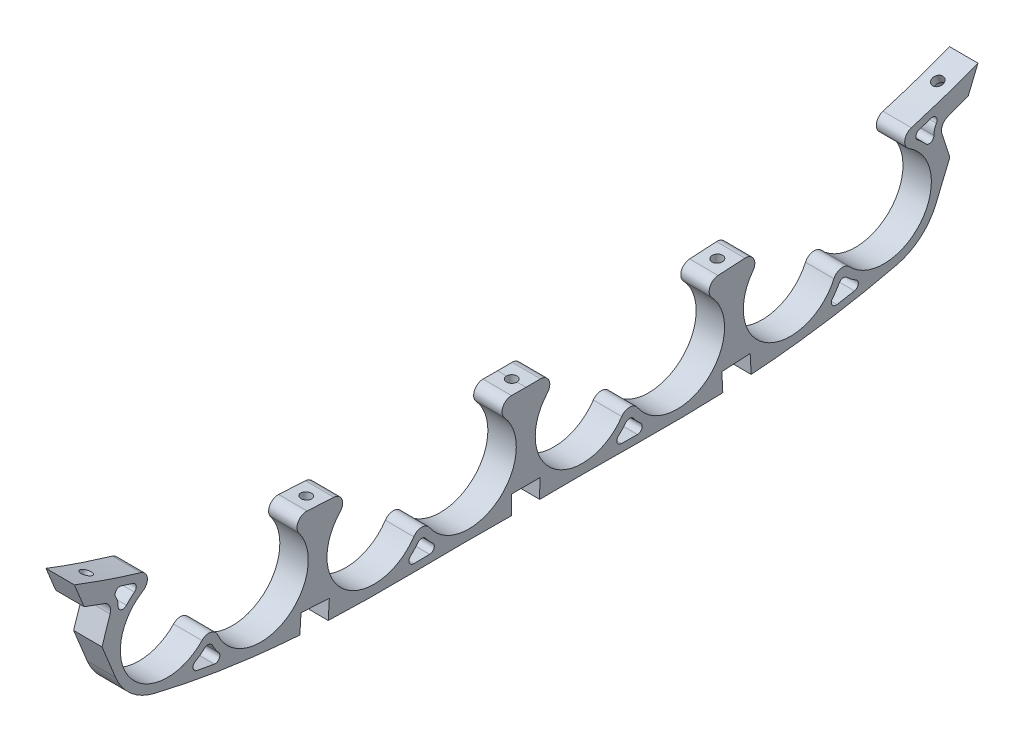
from build123d import *

# Parameters (mm, degrees)
BOSS_EXTRUDE2_START = -4.7625
BOSS_EXTRUDE2_DEPTH = 9.525
CUT_EXTRUDE1_DEPTH  = 156.415453264
SKETCH3_R           = 1.778
CUT_EXTRUDE2_DEPTH  = 156.084029674
SKETCH4_R           = 1.778
CUT_EXTRUDE3_DEPTH  = 154.633346002
SKETCH5_R           = 3.175
CUT_EXTRUDE4_DEPTH  = 3.556
SKETCH6_R           = 1.778
CUT_EXTRUDE5_DEPTH  = 141.617711282


# Read off the part's stored shape, not the designer's step: Boss-Extrude2
with BuildPart() as part:
    # Boss-Extrude2 outline → Boss-Extrude2 (new body)
    with BuildSketch(Plane(origin=(-4.793989049, 0.020738597, -8e-09), x_dir=(-1.5740645192279891e-09, 3.5988585896806374e-12, 1.0), z_dir=(-0.9999906431736159, 0.00432591784689156, -1.5740653593461668e-09)).offset(BOSS_EXTRUDE2_START)):
        with BuildLine():
            Line((-138.072044535, -17.418672385), (-133.45193308, -28.653173914))
            ThreePointArc((-133.45193308, -28.653173914), (-128.289952655, -35.791230264), (-120.447393147, -39.802732565))
            add(Edge.make_bspline(
                [(-120.447393147, -39.802732565), (-119.532951115, -40.023476944), (-117.088169027, -40.601323697), (-110.953698267, -41.968369708), (-101.9631708, -43.710437587), (-90.800466979, -45.403836777), (-79.689088478, -46.662973433), (-68.62645086, -47.527275454), (-57.58924724, -48.037878216), (-46.678774083, -48.224931934), (-36.12400945, -48.204712413), (-25.891642086, -48.098211972), (-17.621930281, -48.025348577), (-11.245188421, -48.026081616), (-6.353163032, -48.062670944), (-2.777855823, -48.097005295), (-0.863208778, -48.112845404), (-0.665350758, -48.114448781)],
                knots=[0.270797205, 0.270797205, 0.270797205, 0.270797205, 0.286422205, 0.3125, 0.375, 0.4375, 0.5, 0.5625, 0.625, 0.6875, 0.75, 0.8125, 0.875, 0.90625, 0.9375, 0.96875, 0.972344137, 0.972344137, 0.972344137, 0.972344137], degree=3))
            Line((-0.665350758, -48.114448781), (-0.665350758, -41.793027475))
            Line((-0.665350758, -41.793027475), (4.097149249, -41.793027475))
            Line((4.097149249, -41.793027475), (4.097149249, -13.091259669))
            add(Edge.make_bspline(
                [(-0.77284529, -13.060384989), (0.850702359, -13.073891325), (2.474025926, -13.085351705), (4.097149249, -13.091259669)],
                knots=[0.969923956, 0.969923956, 0.969923956, 0.969923956, 1, 1, 1, 1], degree=3))
            ThreePointArc((-0.77284529, -13.060384989), (-3.639917153, -14.954181234), (-3.104472125, -18.348273735))
            ThreePointArc((-3.104472125, -18.348273735), (-5.224674561, -41.458905114), (-28.135499878, -37.75882074))
            ThreePointArc((-28.135499878, -37.75882074), (-30.788793596, -36.352857657), (-33.427092785, -37.786760419))
            ThreePointArc((-33.427092785, -37.786760419), (-56.555344229, -41.528795139), (-58.222773785, -18.159188437))
            ThreePointArc((-58.222773785, -18.159188437), (-57.571640051, -14.813961347), (-60.325385318, -12.806125092))
            add(Edge.make_bspline(
                [(-69.337142456, -12.29114456), (-66.34151202, -12.505674943), (-63.337824033, -12.676142272), (-60.325385318, -12.806125092)],
                knots=[0.544342528, 0.544342528, 0.544342528, 0.544342528, 0.601001878, 0.601001878, 0.601001878, 0.601001878], degree=3))
            ThreePointArc((-69.337142456, -12.29114456), (-72.301979587, -13.96996524), (-72.039404171, -17.366986324))
            ThreePointArc((-72.039404171, -17.366986324), (-76.727036431, -40.596572868), (-99.26938115, -33.286970841))
            ThreePointArc((-99.26938115, -33.286970841), (-101.634862692, -31.437323087), (-104.483804941, -32.386126439))
            ThreePointArc((-104.483804941, -32.386126439), (-128.322582254, -31.527253859), (-124.396922416, -7.998247065))
            ThreePointArc((-124.396922416, -7.998247065), (-122.920666522, -4.906404126), (-125.113082538, -2.273509096))
            add(Edge.make_bspline(
                [(-147.427204302, 5.329817062), (-146.245143462, 4.87057829), (-145.060729116, 4.420056913), (-140.77844611, 2.824904825), (-137.662571865, 1.726883825), (-131.406857013, -0.357749795), (-128.269220076, -1.343570319), (-125.113082538, -2.273509096)],
                knots=[0.038524248, 0.038524248, 0.038524248, 0.038524248, 0.0625, 0.0625, 0.125, 0.125, 0.18699398, 0.18699398, 0.18699398, 0.18699398], degree=3))
            Line((-147.427204302, 5.329817062), (-144.129131172, -2.689947823))
            Line((-144.129131172, -2.689947823), (-137.314660328, -5.188999258))
            ThreePointArc((-137.314660328, -5.188999258), (-135.552656607, -6.781124671), (-135.387954249, -9.150173758))
            Line((-135.387954249, -9.150173758), (-138.072044535, -17.418672385))
        make_face()
    boss_extrude2 = extrude(amount=BOSS_EXTRUDE2_DEPTH)

    # Sketch2 → Cut-Extrude1 (cut, symmetric)
    with BuildSketch(Plane(origin=(-9.556444487, 0.041340781, -1.5e-08), x_dir=(-1.574050630268585e-09, 6.809277426616461e-12, 1.0), z_dir=(-0.9999906431736159, 0.004325917846891559, -1.5740653585248619e-09))):
        with BuildLine():
            add(Edge.make_bspline(
                [(-127.746028761, -4.117046193), (-127.920864487, -4.062228411), (-128.497438155, -3.880834796), (-129.474764314, -3.56992572), (-130.61167639, -3.202689207), (-131.346711169, -2.961963385), (-131.681461046, -2.85164983)],
                knots=[0.050531782, 0.050531782, 0.050531782, 0.050531782, 0.053922838, 0.061719646, 0.069516453, 0.076045432, 0.076045432, 0.076045432, 0.076045432], degree=3))
            ThreePointArc((-131.681461046, -2.85164983), (-133.422558837, -3.373474429), (-133.532562844, -5.187757083))
            ThreePointArc((-133.532562844, -5.187757083), (-132.888352117, -6.687775552), (-132.694514871, -8.308728972))
            ThreePointArc((-132.694514871, -8.308728972), (-131.68228373, -9.827084089), (-129.910539028, -9.390123157))
            ThreePointArc((-129.910539028, -9.390123157), (-128.64389438, -8.074171244), (-127.253117249, -6.890170792))
            ThreePointArc((-127.253117249, -6.890170792), (-126.657972084, -5.354017384), (-127.746028761, -4.117046193))
        make_face()
        with BuildLine():
            ThreePointArc((-103.531454864, -35.014583834), (-105.046370881, -36.270658322), (-106.686675106, -37.357900572))
            ThreePointArc((-106.686675106, -37.357900572), (-107.445658928, -38.997677259), (-106.17831741, -40.285609518))
            add(Edge.make_bspline(
                [(-106.17831741, -40.285609518), (-105.689424337, -40.378639287), (-104.711253765, -40.562073564), (-103.243222942, -40.829245575), (-101.774672224, -41.088398866), (-100.795508991, -41.255698274), (-100.305943671, -41.337993115)],
                knots=[0.348717241, 0.348717241, 0.348717241, 0.348717241, 0.357017497, 0.365317753, 0.37361801, 0.381918266, 0.381918266, 0.381918266, 0.381918266], degree=3))
            ThreePointArc((-100.305943671, -41.337993115), (-98.66420871, -40.55966513), (-98.828229808, -38.750194154))
            ThreePointArc((-98.828229808, -38.750194154), (-100.027971586, -37.157075068), (-101.048395916, -35.443557359))
            ThreePointArc((-101.048395916, -35.443557359), (-102.184087051, -34.616438766), (-103.531454864, -35.014583834))
        make_face()
        with BuildLine():
            add(Edge.make_bspline(
                [(-71.5828354, -47.271978618), (-70.598435188, -47.341719534), (-67.425281809, -47.552630609), (-64.255272578, -47.719817442), (-62.07334976, -47.815401582)],
                knots=[0.545807774, 0.545807774, 0.545807774, 0.545807774, 0.5625, 0.599634716, 0.599634716, 0.599634716, 0.599634716], degree=3))
            Line((-62.07334976, -47.815401582), (-61.713409045, -41.507326545))
            Line((-61.713409045, -41.507326545), (-71.222940683, -40.964709724))
            Line((-71.222940683, -40.964709724), (-71.5828354, -47.271978618))
        make_face()
        with BuildLine():
            ThreePointArc((-32.028379906, -40.207372166), (-33.189236423, -41.591748315), (-34.480162394, -42.855708484))
            ThreePointArc((-34.480162394, -42.855708484), (-34.908363074, -44.612613191), (-33.413774747, -45.630589469))
            add(Edge.make_bspline(
                [(-33.413774747, -45.630589469), (-32.965810837, -45.626992717), (-32.071534178, -45.619472638), (-30.73513395, -45.607427742), (-29.403652527, -45.594865531), (-28.519261525, -45.586295989), (-28.077877376, -45.582002891)],
                knots=[0.766813177, 0.766813177, 0.766813177, 0.766813177, 0.774973862, 0.783134546, 0.79129523, 0.799455915, 0.799455915, 0.799455915, 0.799455915], degree=3))
            ThreePointArc((-28.077877376, -45.582002891), (-26.60398535, -44.544165428), (-27.050423166, -42.797695394))
            ThreePointArc((-27.050423166, -42.797695394), (-28.342931358, -41.555770069), (-29.508573761, -40.194067557))
            ThreePointArc((-29.508573761, -40.194067557), (-30.771759408, -39.579021592), (-32.028379906, -40.207372166))
        make_face()
    cut_extrude1 = extrude(amount=CUT_EXTRUDE1_DEPTH, both=True, mode=Mode.SUBTRACT)

    # Sketch3 → Cut-Extrude2 (cut, through all)
    with BuildSketch(Plane(origin=(-0.180793203, -41.792636425, 0), x_dir=(0.9999906431736159, -0.0043259178468915615, -1.3888719940127347e-14), z_dir=(-0.0043259178468915615, -0.9999906431736159, -3.2105533385859324e-12))):
        with Locations((-4.794033913, 4.097149242)):
            Circle(SKETCH3_R)
    cut_extrude2 = extrude(amount=-CUT_EXTRUDE2_DEPTH, mode=Mode.SUBTRACT)

    # Sketch4 → Cut-Extrude3 (cut, through all)
    with BuildSketch(Plane(origin=(-0.194158352, -44.882160572, -2.561013947), x_dir=(-0.9999906735399714, 0.0043118786384133394, 0.000246040000931544), z_dir=(-0.004318892575008476, -0.9983666834206391, -0.056967645226033474))):
        with Locations(Location((4.777085058, 64.011158923, 0), (0, 0, 90.000000032))):
            Circle(SKETCH4_R)
    cut_extrude3 = extrude(amount=-CUT_EXTRUDE3_DEPTH, mode=Mode.SUBTRACT)

    # Sketch5 → Cut-Extrude4 (cut)
    with BuildSketch(Plane(origin=(-0.211802404, -48.960812091, -17.955426855), x_dir=(0.9999917519221775, -0.003823650309176084, -0.0013695933438228054), z_dir=(-0.004061421872744406, -0.9388491775454144, -0.3443047003377539))):
        with Locations(Location((-4.596082661, -130.968464784, 0), (0, 0, 269.998243343))):
            Circle(SKETCH5_R)
    cut_extrude4 = extrude(amount=-CUT_EXTRUDE4_DEPTH, mode=Mode.SUBTRACT)

    # Sketch6 → Cut-Extrude5 (cut, through all)
    with BuildSketch(Plane(origin=(-0.197359988, -45.622264416, -16.731079341), x_dir=(-0.9999917519221775, 0.0038236503091760845, 0.0013695933438228056), z_dir=(-0.004061421872744406, -0.9388491775454144, -0.34430470033775384))):
        with Locations(Location((4.596082661, 130.968464784, 0), (0, 0, 89.998243343))):
            Circle(SKETCH6_R)
    cut_extrude5 = extrude(amount=-CUT_EXTRUDE5_DEPTH, mode=Mode.SUBTRACT)

    # Mirror1: Boss-Extrude2, Cut-Extrude1, Cut-Extrude2, Cut-Extrude3, Cut-Extrude4, Cut-Extrude5 across plane
    add(boss_extrude2.mirror(Plane(origin=(-0.031533617, 0.000136413, 4.097149249), x_dir=(1.0, 0, 1.5740645186890284e-09), z_dir=(1.5740645186890284e-09, -3.598983177295524e-12, -1.0))))
    add(cut_extrude1.mirror(Plane(origin=(-0.031533617, 0.000136413, 4.097149249), x_dir=(1.0, 0, 1.5740645186890284e-09), z_dir=(1.5740645186890284e-09, -3.598983177295524e-12, -1.0))), mode=Mode.SUBTRACT)
    add(cut_extrude2.mirror(Plane(origin=(-0.031533617, 0.000136413, 4.097149249), x_dir=(1.0, 0, 1.5740645186890284e-09), z_dir=(1.5740645186890284e-09, -3.598983177295524e-12, -1.0))), mode=Mode.SUBTRACT)
    add(cut_extrude3.mirror(Plane(origin=(-0.031533617, 0.000136413, 4.097149249), x_dir=(1.0, 0, 1.5740645186890284e-09), z_dir=(1.5740645186890284e-09, -3.598983177295524e-12, -1.0))), mode=Mode.SUBTRACT)
    add(cut_extrude4.mirror(Plane(origin=(-0.031533617, 0.000136413, 4.097149249), x_dir=(1.0, 0, 1.5740645186890284e-09), z_dir=(1.5740645186890284e-09, -3.598983177295524e-12, -1.0))), mode=Mode.SUBTRACT)
    add(cut_extrude5.mirror(Plane(origin=(-0.031533617, 0.000136413, 4.097149249), x_dir=(1.0, 0, 1.5740645186890284e-09), z_dir=(1.5740645186890284e-09, -3.598983177295524e-12, -1.0))), mode=Mode.SUBTRACT)


solid = part.part
